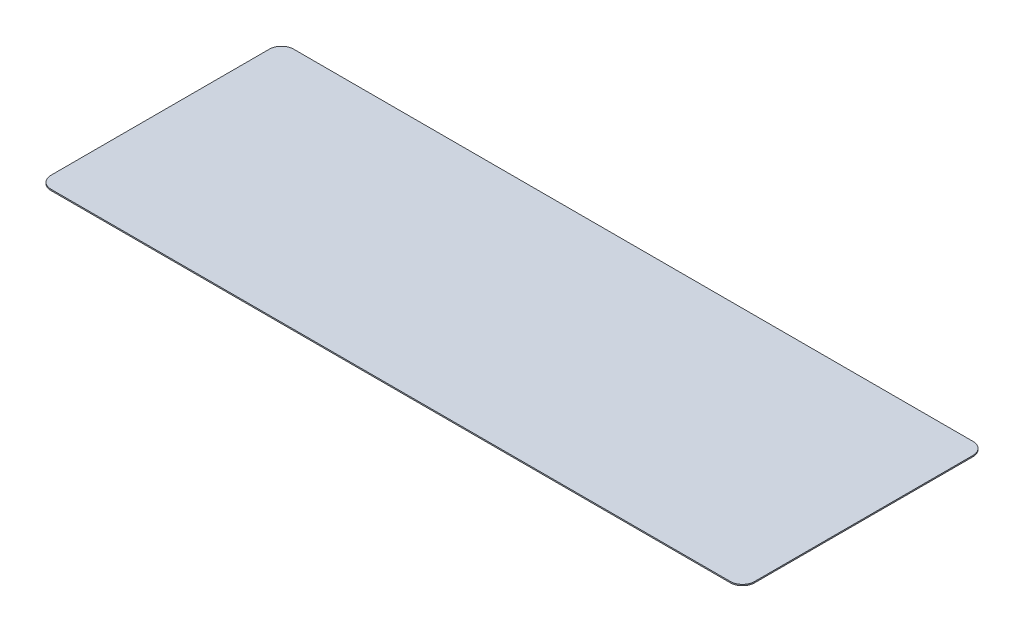
from build123d import *

# Parameters (mm, degrees)
SKETCH1_W           = 580
SKETCH1_H           = 200
BOSS_EXTRUDE1_DEPTH = 1
FILLET1_R           = 10


with BuildPart() as part:
    # Sketch1 → Boss-Extrude1 (new body)
    with BuildSketch(Plane(origin=(0, 0, 0), x_dir=(1, 0, 0), z_dir=(0, 1, 0))):
        Rectangle(SKETCH1_W, SKETCH1_H)
    extrude(amount=BOSS_EXTRUDE1_DEPTH)

    # Fillet1
    fillet1_edges = [part.edges().sort_by_distance(p)[0] for p in [
        (-290, 0.5, 100),
        (290, 0.5, 100),
        (290, 0.5, -100),
        (-290, 0.5, -100),
    ]]
    fillet(fillet1_edges, radius=FILLET1_R)


solid = part.part
